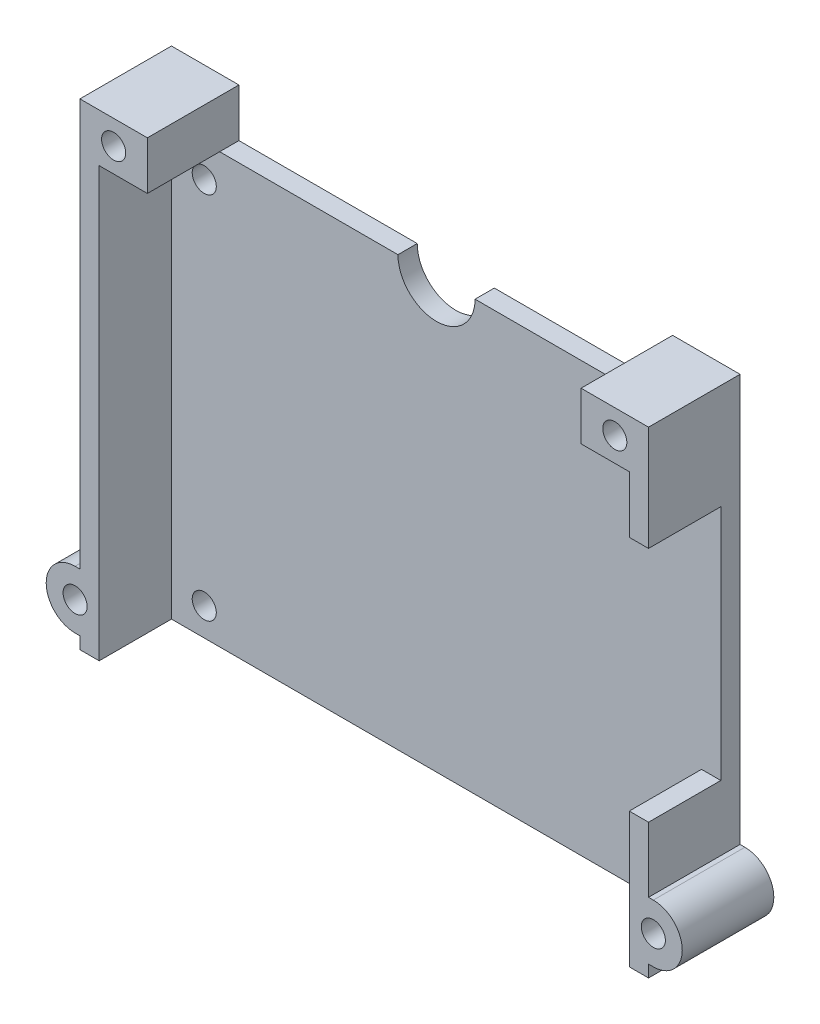
from build123d import *

# Parameters (mm, degrees)
BOSS_EXTRUDE1_DEPTH = 44.5
SKETCH2_W           = 7.5
SKETCH2_H           = 24.6
CUT_EXTRUDE1_DEPTH  = 10
BOSS_EXTRUDE2_DEPTH = 9.5
CUT_EXTRUDE2_DEPTH  = 11
SKETCH4_W           = 7
SKETCH4_H           = 9.5
BOSS_EXTRUDE3_DEPTH = 5
SKETCH5_R           = 1.25
CUT_EXTRUDE3_DEPTH  = 81.291655855
SKETCH7_R           = 1.25
CUT_EXTRUDE4_DEPTH  = 10
SKETCH8_R           = 4
CUT_EXTRUDE5_DEPTH  = 81.291655855


with BuildPart() as part:
    # Sketch1 → Boss-Extrude1 (new body)
    with BuildSketch(Plane(origin=(0, 0, 0), x_dir=(1, 0, 0), z_dir=(0, 1, 0))):
        Polygon((0, 0), (2, 0), (2, 7.5), (57, 7.5), (57, 0), (59, 0), (59, 9.5), (0, 9.5), align=None)
    extrude(amount=BOSS_EXTRUDE1_DEPTH)

    # Sketch2 → Cut-Extrude1 (cut)
    with BuildSketch(Plane(origin=(59, 0, 0), x_dir=(0, 0, -1), z_dir=(1, 0, 0))):
        with Locations((3.75, 26.3)):
            Rectangle(SKETCH2_W, SKETCH2_H)
    extrude(amount=-CUT_EXTRUDE1_DEPTH, mode=Mode.SUBTRACT)

    # Sketch3 → Boss-Extrude2 (add)
    with BuildSketch(Plane(origin=(0, 0, -9.5), x_dir=(-1, 0, 0), z_dir=(0, 0, -1))):
        with BuildLine():
            Line((-59, 5.395643924), (-59, 7.25))
            Line((-59, 7.25), (-59.5, 7.25))
            ThreePointArc((-59.5, 7.25), (-62.5, 4.25), (-59.5, 1.25))
            Line((-59.5, 1.25), (-59, 1.25))
            Line((-59, 1.25), (-59, 3.104356076))
            ThreePointArc((-59, 3.104356076), (-60.75, 4.25), (-59, 5.395643924))
        make_face()
        with BuildLine():
            Line((0.5, 7.25), (0, 7.25))
            Line((0, 7.25), (0, 5.395643924))
            ThreePointArc((0, 5.395643924), (1.75, 4.25), (0, 3.104356076))
            Line((0, 3.104356076), (0, 1.25))
            Line((0, 1.25), (0.5, 1.25))
            ThreePointArc((0.5, 1.25), (3.5, 4.25), (0.5, 7.25))
        make_face()
    extrude(amount=-BOSS_EXTRUDE2_DEPTH)

    # Sketch3<3> → Cut-Extrude2 (cut)
    with BuildSketch(Plane(origin=(0, 0, -9.5), x_dir=(-1, 0, 0), z_dir=(0, 0, -1))):
        with BuildLine():
            ThreePointArc((-59, 3.104356076), (-58.25, 4.25), (-59, 5.395643924))
            Line((-59, 5.395643924), (-59, 3.104356076))
        make_face()
        with BuildLine():
            Line((0, 3.104356076), (0, 5.395643924))
            ThreePointArc((0, 5.395643924), (-0.75, 4.25), (0, 3.104356076))
        make_face()
    extrude(amount=-CUT_EXTRUDE2_DEPTH, mode=Mode.SUBTRACT)

    # Sketch4 → Boss-Extrude3 (add)
    with BuildSketch(Plane(origin=(0, 44.5, 0), x_dir=(1, 0, 0), z_dir=(0, 1, 0))):
        with Locations((3.5, 4.75)):
            Rectangle(SKETCH4_W, SKETCH4_H)
        with Locations((55.5, 4.75)):
            Rectangle(SKETCH4_W, SKETCH4_H)
    extrude(amount=BOSS_EXTRUDE3_DEPTH)

    # Sketch5 → Cut-Extrude3 (cut, through all)
    with BuildSketch(Plane(origin=(0, 0, -9.5), x_dir=(-1, 0, 0), z_dir=(0, 0, -1))):
        with Locations((-55.5, 47)):
            Circle(SKETCH5_R)
        with Locations((-3.5, 47)):
            Circle(SKETCH5_R)
    extrude(amount=-CUT_EXTRUDE3_DEPTH, mode=Mode.SUBTRACT)

    # Sketch7 → Cut-Extrude4 (cut)
    with BuildSketch(Plane(origin=(0, 0, -9.5), x_dir=(-1, 0, 0), z_dir=(0, 0, -1))):
        with Locations((-5.4, 2.9)):
            Circle(SKETCH7_R)
        with Locations((-53.6, 2.9)):
            Circle(SKETCH7_R)
        with Locations((-53.6, 41.2)):
            Circle(SKETCH7_R)
        with Locations((-5.4, 41.2)):
            Circle(SKETCH7_R)
    extrude(amount=-CUT_EXTRUDE4_DEPTH, mode=Mode.SUBTRACT)

    # Sketch8 → Cut-Extrude5 (cut, through all)
    with BuildSketch(Plane(origin=(0, 0, -9.5), x_dir=(-1, 0, 0), z_dir=(0, 0, -1))):
        with Locations((-29.5, 44.5)):
            Circle(SKETCH8_R)
    extrude(amount=-CUT_EXTRUDE5_DEPTH, mode=Mode.SUBTRACT)


solid = part.part
